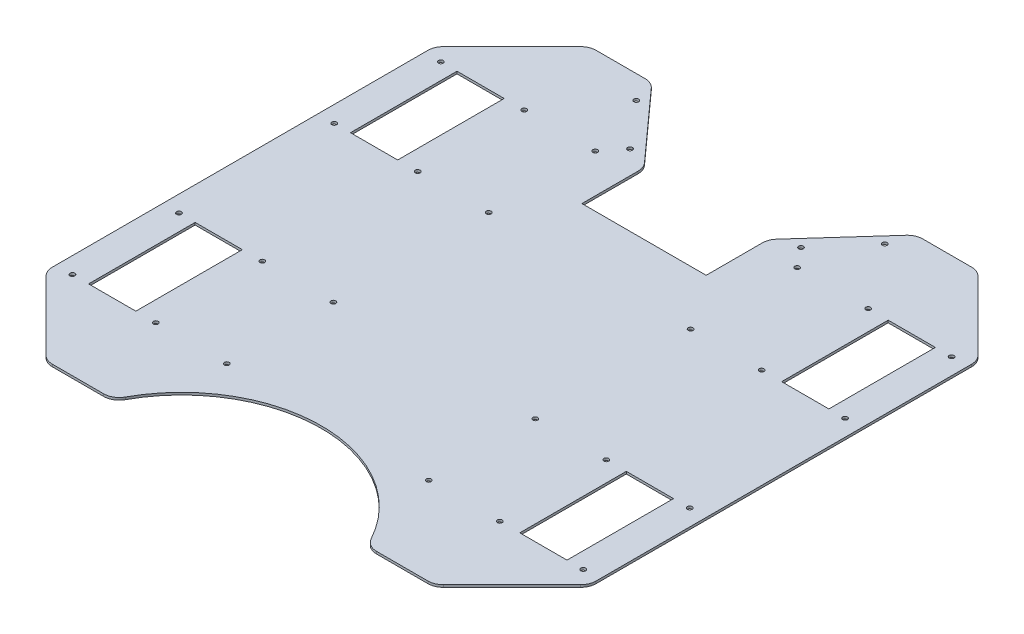
from build123d import *

# Parameters (mm, degrees)
SKETCH_1_R      = 1.55
SKETCH_1_W      = 30.4
SKETCH_1_H      = 68.58
EXTRUDE_1_DEPTH = 1.5
FILLET_1_R      = 10
FILLET_2_R      = 10
FILLET_3_R      = 10


with BuildPart() as part:
    # 草图1 → 凸台-拉伸1 (new body)
    with BuildSketch(Plane(origin=(0, 0, 0), x_dir=(1, 0, 0), z_dir=(0, 1, 0))):
        with BuildLine():
            Line((-125, 175), (-175, 125))
            Line((-175, 125), (-175, -125))
            Line((-175, -125), (-125, -175))
            Line((-125, -175), (-81.710313025, -175))
            ThreePointArc((-81.710313025, -175), (0, -122.728301649), (81.710313025, -175))
            Line((81.710313025, -175), (125, -175))
            Line((125, -175), (175, -125))
            Line((175, -125), (175, 125))
            Line((175, 125), (125, 175))
            Line((125, 175), (85, 175))
            Line((85, 175), (40, 125))
            Line((40, 125), (40, 85))
            Line((40, 85), (-40, 85))
            Line((-40, 85), (-40, 125))
            Line((-40, 125), (-85, 175))
            Line((-85, 175), (-125, 175))
        make_face()
        with Locations((-55, 131)):
            Circle(SKETCH_1_R, mode=Mode.SUBTRACT)
        with Locations((-80, 160)):
            Circle(SKETCH_1_R, mode=Mode.SUBTRACT)
        with Locations((55, 131)):
            Circle(SKETCH_1_R, mode=Mode.SUBTRACT)
        with Locations((80, 160)):
            Circle(SKETCH_1_R, mode=Mode.SUBTRACT)
        with Locations((-65, 118.58)):
            Circle(SKETCH_1_R, mode=Mode.SUBTRACT)
        with Locations((-65, 50)):
            Circle(SKETCH_1_R, mode=Mode.SUBTRACT)
        with Locations((-110.72, 50)):
            Circle(SKETCH_1_R, mode=Mode.SUBTRACT)
        with Locations((-110.72, 118.58)):
            Circle(SKETCH_1_R, mode=Mode.SUBTRACT)
        with Locations((-164.434, 118.58)):
            Circle(SKETCH_1_R, mode=Mode.SUBTRACT)
        with Locations((-164.434, 50)):
            Circle(SKETCH_1_R, mode=Mode.SUBTRACT)
        with Locations((-65, -118.58)):
            Circle(SKETCH_1_R, mode=Mode.SUBTRACT)
        with Locations((-65, -50)):
            Circle(SKETCH_1_R, mode=Mode.SUBTRACT)
        with Locations((-110.72, -50)):
            Circle(SKETCH_1_R, mode=Mode.SUBTRACT)
        with Locations((-110.72, -118.58)):
            Circle(SKETCH_1_R, mode=Mode.SUBTRACT)
        with Locations((-164.434, -50)):
            Circle(SKETCH_1_R, mode=Mode.SUBTRACT)
        with Locations((-164.434, -118.58)):
            Circle(SKETCH_1_R, mode=Mode.SUBTRACT)
        with Locations((65, 50)):
            Circle(SKETCH_1_R, mode=Mode.SUBTRACT)
        with Locations((110.72, 50)):
            Circle(SKETCH_1_R, mode=Mode.SUBTRACT)
        with Locations((110.72, 118.58)):
            Circle(SKETCH_1_R, mode=Mode.SUBTRACT)
        with Locations((65, 118.58)):
            Circle(SKETCH_1_R, mode=Mode.SUBTRACT)
        with Locations((164.434, 118.58)):
            Circle(SKETCH_1_R, mode=Mode.SUBTRACT)
        with Locations((164.434, 50)):
            Circle(SKETCH_1_R, mode=Mode.SUBTRACT)
        with Locations((164.434, -118.58)):
            Circle(SKETCH_1_R, mode=Mode.SUBTRACT)
        with Locations((164.434, -50)):
            Circle(SKETCH_1_R, mode=Mode.SUBTRACT)
        with Locations((110.72, -50)):
            Circle(SKETCH_1_R, mode=Mode.SUBTRACT)
        with Locations((110.72, -118.58)):
            Circle(SKETCH_1_R, mode=Mode.SUBTRACT)
        with Locations((65, -118.58)):
            Circle(SKETCH_1_R, mode=Mode.SUBTRACT)
        with Locations((65, -50)):
            Circle(SKETCH_1_R, mode=Mode.SUBTRACT)
        with Locations((-138.794, 84.29)):
            Rectangle(SKETCH_1_W, SKETCH_1_H, mode=Mode.SUBTRACT)
        with Locations((138.794, 84.29)):
            Rectangle(SKETCH_1_W, SKETCH_1_H, mode=Mode.SUBTRACT)
        with Locations((-138.794, -84.29)):
            Rectangle(SKETCH_1_W, SKETCH_1_H, mode=Mode.SUBTRACT)
        with Locations((138.794, -84.29)):
            Rectangle(SKETCH_1_W, SKETCH_1_H, mode=Mode.SUBTRACT)
    extrude(amount=EXTRUDE_1_DEPTH)

    # 圆角1
    fillet_1_edges = [part.edges().sort_by_distance(p)[0] for p in [
        (-40, 0.75, -125),
    ]]
    fillet(fillet_1_edges, radius=FILLET_1_R)

    # 圆角2
    fillet_2_edges = [part.edges().sort_by_distance(p)[0] for p in [
        (40, 0.75, -125),
    ]]
    fillet(fillet_2_edges, radius=FILLET_2_R)

    # 圆角3
    fillet_3_edges = [part.edges().sort_by_distance(p)[0] for p in [
        (-85, 0.75, -175),
        (85, 0.75, -175),
        (125, 0.75, -175),
        (175, 0.75, -125),
        (175, 0.75, 125),
        (125, 0.75, 175),
        (81.710313025, 0.75, 175),
        (-81.710313025, 0.75, 175),
        (-125, 0.75, 175),
        (-175, 0.75, 125),
        (-175, 0.75, -125),
        (-125, 0.75, -175),
    ]]
    fillet(fillet_3_edges, radius=FILLET_3_R)


solid = part.part
